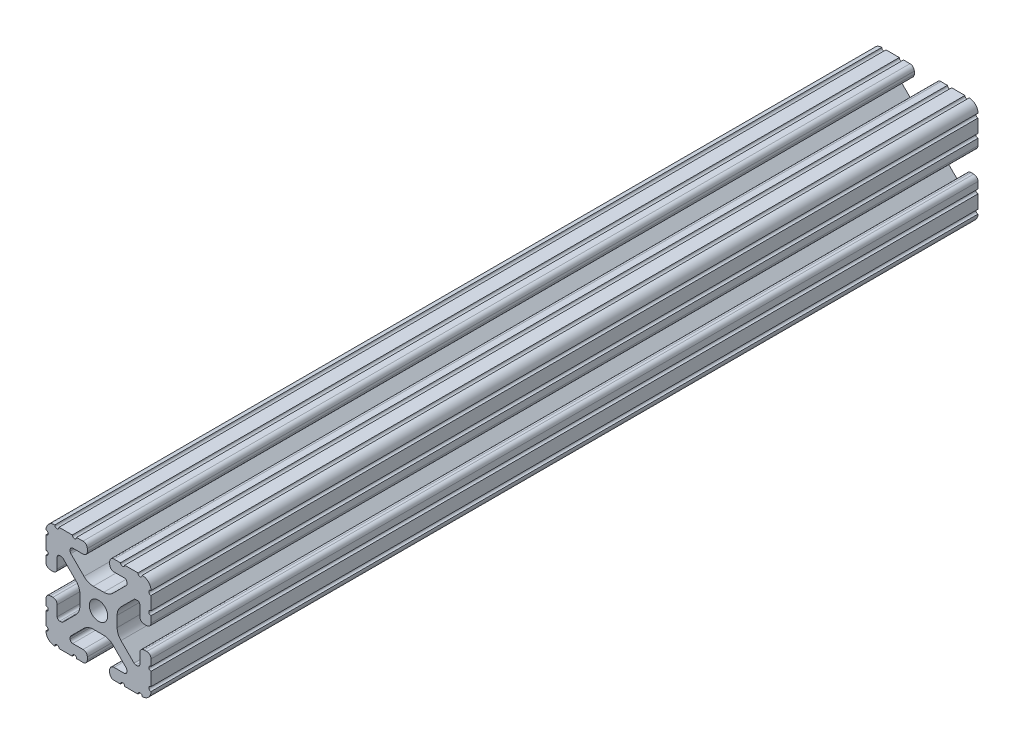
from build123d import *

# Parameters (mm, degrees)
SKETCH1_R      = 3.3274
EXTRUDE1_DEPTH = 300


with BuildPart() as part:
    # Sketch1 → Extrude1 (new body)
    with BuildSketch(Plane.XY):
        with BuildLine():
            Line((-10.022898969, 12.91475973), (-5.252158105, 8.144007132))
            ThreePointArc((-5.252158105, 8.144007132), (-3.715177372, 7.117027388), (-1.902183975, 6.7564))
            Line((-1.902183975, 6.7564), (1.902183975, 6.7564))
            ThreePointArc((1.902183975, 6.7564), (3.715177372, 7.117027388), (5.252158105, 8.144007132))
            Line((5.252158105, 8.144007132), (10.022898969, 12.91475973))
            ThreePointArc((10.022898969, 12.91475973), (10.218362387, 13.207291992), (10.287, 13.552357131))
            Line((10.287, 13.552357131), (10.287, 14.0843))
            ThreePointArc((10.287, 14.0843), (10.022898185, 14.721898185), (9.3853, 14.986))
            Line((9.3853, 14.986), (5.617617549, 14.986))
            ThreePointArc((5.617617549, 14.986), (4.519044045, 15.441044045), (4.064, 16.539617549))
            Line((4.064, 16.539617549), (4.064, 17.496382451))
            ThreePointArc((4.064, 17.496382451), (4.519044045, 18.594955955), (5.617617549, 19.05))
            Line((5.617617549, 19.05), (7.974178704, 19.05))
            ThreePointArc((7.974178704, 19.05), (8.736178704, 18.288), (9.498178704, 19.05))
            Line((9.498178704, 19.05), (14.327719207, 19.05))
            ThreePointArc((14.327719207, 19.05), (15.087603123, 18.231251131), (15.847487039, 19.05))
            ThreePointArc((15.847487039, 19.05), (18.120176289, 18.120192083), (19.05, 15.847509295))
            ThreePointArc((19.05, 15.847509295), (18.231250992, 15.08762539), (19.05, 14.327741484))
            Line((19.05, 14.327741484), (19.05, 9.496091471))
            ThreePointArc((19.05, 9.496091471), (18.231250992, 8.736207565), (19.05, 7.97632366))
            Line((19.05, 7.97632366), (19.05, 5.617617549))
            ThreePointArc((19.05, 5.617617549), (18.594955955, 4.519044045), (17.496382451, 4.064))
            Line((17.496382451, 4.064), (16.539617549, 4.064))
            ThreePointArc((16.539617549, 4.064), (15.441044045, 4.519044045), (14.986, 5.617617549))
            Line((14.986, 5.617617549), (14.986, 9.385342516))
            ThreePointArc((14.986, 9.385342516), (14.721898185, 10.022940701), (14.0843, 10.287042516))
            Line((14.0843, 10.287042516), (13.516042086, 10.287042516))
            ThreePointArc((13.516042086, 10.287042516), (13.170975923, 10.218404478), (12.878443117, 10.022939917))
            Line((12.878443117, 10.022939917), (8.14758008, 5.292065243))
            ThreePointArc((8.14758008, 5.292065243), (7.117955879, 3.751120653), (6.7564, 1.933453584))
            Line((6.7564, 1.933453584), (6.7564, -1.933453584))
            ThreePointArc((6.7564, -1.933453584), (7.117955879, -3.751120653), (8.14758008, -5.292065243))
            Line((8.14758008, -5.292065243), (12.878443117, -10.022939917))
            ThreePointArc((12.878443117, -10.022939917), (13.170975923, -10.218404478), (13.516042086, -10.287042516))
            Line((13.516042086, -10.287042516), (14.0843, -10.287042516))
            ThreePointArc((14.0843, -10.287042516), (14.721898185, -10.022940701), (14.986, -9.385342516))
            Line((14.986, -9.385342516), (14.986, -5.617617549))
            ThreePointArc((14.986, -5.617617549), (15.441044045, -4.519044045), (16.539617549, -4.064))
            Line((16.539617549, -4.064), (17.496382451, -4.064))
            ThreePointArc((17.496382451, -4.064), (18.594955955, -4.519044045), (19.05, -5.617617549))
            Line((19.05, -5.617617549), (19.05, -7.976318491))
            ThreePointArc((19.05, -7.976318491), (18.231250992, -8.736202396), (19.05, -9.496086302))
            Line((19.05, -9.496086302), (19.05, -14.32774291))
            ThreePointArc((19.05, -14.32774291), (18.231250992, -15.087626816), (19.05, -15.847510721))
            ThreePointArc((19.05, -15.847510721), (18.120175716, -18.120192644), (15.847486868, -19.05))
            ThreePointArc((15.847486868, -19.05), (15.087602952, -18.231251131), (14.327719036, -19.05))
            Line((14.327719036, -19.05), (9.496062448, -19.05))
            ThreePointArc((9.496062448, -19.05), (8.736178532, -18.231251131), (7.976294616, -19.05))
            Line((7.976294616, -19.05), (5.617617549, -19.05))
            ThreePointArc((5.617617549, -19.05), (4.519044045, -18.594955955), (4.064, -17.496382451))
            Line((4.064, -17.496382451), (4.064, -16.539617549))
            ThreePointArc((4.064, -16.539617549), (4.519044045, -15.441044045), (5.617617549, -14.986))
            Line((5.617617549, -14.986), (9.3853, -14.986))
            ThreePointArc((9.3853, -14.986), (10.022898185, -14.721898185), (10.287, -14.0843))
            Line((10.287, -14.0843), (10.287, -13.552357131))
            ThreePointArc((10.287, -13.552357131), (10.218362387, -13.207291992), (10.022898969, -12.91475973))
            Line((10.022898969, -12.91475973), (5.252158105, -8.144007132))
            ThreePointArc((5.252158105, -8.144007132), (3.715177372, -7.117027388), (1.902183975, -6.7564))
            Line((1.902183975, -6.7564), (-1.902183975, -6.7564))
            ThreePointArc((-1.902183975, -6.7564), (-3.715177372, -7.117027388), (-5.252158105, -8.144007132))
            Line((-5.252158105, -8.144007132), (-10.022898969, -12.91475973))
            ThreePointArc((-10.022898969, -12.91475973), (-10.218362387, -13.207291992), (-10.287, -13.552357131))
            Line((-10.287, -13.552357131), (-10.287, -14.0843))
            ThreePointArc((-10.287, -14.0843), (-10.022898185, -14.721898185), (-9.3853, -14.986))
            Line((-9.3853, -14.986), (-5.617617549, -14.986))
            ThreePointArc((-5.617617549, -14.986), (-4.519044045, -15.441044045), (-4.064, -16.539617549))
            Line((-4.064, -16.539617549), (-4.064, -17.496382451))
            ThreePointArc((-4.064, -17.496382451), (-4.519044045, -18.594955955), (-5.617617549, -19.05))
            Line((-5.617617549, -19.05), (-7.976294616, -19.05))
            ThreePointArc((-7.976294616, -19.05), (-8.736178532, -18.231251131), (-9.496062448, -19.05))
            Line((-9.496062448, -19.05), (-14.327719036, -19.05))
            ThreePointArc((-14.327719036, -19.05), (-15.087602952, -18.231251131), (-15.847486868, -19.05))
            ThreePointArc((-15.847486868, -19.05), (-18.120175716, -18.120192644), (-19.05, -15.847510721))
            ThreePointArc((-19.05, -15.847510721), (-18.231250992, -15.087626816), (-19.05, -14.32774291))
            Line((-19.05, -14.32774291), (-19.05, -9.496086302))
            ThreePointArc((-19.05, -9.496086302), (-18.231250992, -8.736202396), (-19.05, -7.976318491))
            Line((-19.05, -7.976318491), (-19.05, -5.617617549))
            ThreePointArc((-19.05, -5.617617549), (-18.594955955, -4.519044045), (-17.496382451, -4.064))
            Line((-17.496382451, -4.064), (-16.539617549, -4.064))
            ThreePointArc((-16.539617549, -4.064), (-15.441044045, -4.519044045), (-14.986, -5.617617549))
            Line((-14.986, -5.617617549), (-14.986, -9.385342516))
            ThreePointArc((-14.986, -9.385342516), (-14.721898185, -10.022940701), (-14.0843, -10.287042516))
            Line((-14.0843, -10.287042516), (-13.516042086, -10.287042516))
            ThreePointArc((-13.516042086, -10.287042516), (-13.170975923, -10.218404478), (-12.878443117, -10.022939917))
            Line((-12.878443117, -10.022939917), (-8.14758008, -5.292065243))
            ThreePointArc((-8.14758008, -5.292065243), (-7.117955879, -3.751120653), (-6.7564, -1.933453584))
            Line((-6.7564, -1.933453584), (-6.7564, 1.933453584))
            ThreePointArc((-6.7564, 1.933453584), (-7.117955879, 3.751120653), (-8.14758008, 5.292065243))
            Line((-8.14758008, 5.292065243), (-12.878443117, 10.022939917))
            ThreePointArc((-12.878443117, 10.022939917), (-13.170975923, 10.218404478), (-13.516042086, 10.287042516))
            Line((-13.516042086, 10.287042516), (-14.0843, 10.287042516))
            ThreePointArc((-14.0843, 10.287042516), (-14.721898185, 10.022940701), (-14.986, 9.385342516))
            Line((-14.986, 9.385342516), (-14.986, 5.617617549))
            ThreePointArc((-14.986, 5.617617549), (-15.441044045, 4.519044045), (-16.539617549, 4.064))
            Line((-16.539617549, 4.064), (-17.496382451, 4.064))
            ThreePointArc((-17.496382451, 4.064), (-18.594955955, 4.519044045), (-19.05, 5.617617549))
            Line((-19.05, 5.617617549), (-19.05, 7.97632366))
            ThreePointArc((-19.05, 7.97632366), (-18.231250992, 8.736207565), (-19.05, 9.496091471))
            Line((-19.05, 9.496091471), (-19.05, 14.327741484))
            ThreePointArc((-19.05, 14.327741484), (-18.231250992, 15.08762539), (-19.05, 15.847509295))
            ThreePointArc((-19.05, 15.847509295), (-18.120176289, 18.120192083), (-15.847487039, 19.05))
            ThreePointArc((-15.847487039, 19.05), (-15.087603123, 18.231251131), (-14.327719207, 19.05))
            Line((-14.327719207, 19.05), (-9.498178704, 19.05))
            ThreePointArc((-9.498178704, 19.05), (-8.736178704, 18.288), (-7.974178704, 19.05))
            Line((-7.974178704, 19.05), (-5.617617549, 19.05))
            ThreePointArc((-5.617617549, 19.05), (-4.519044045, 18.594955955), (-4.064, 17.496382451))
            Line((-4.064, 17.496382451), (-4.064, 16.539617549))
            ThreePointArc((-4.064, 16.539617549), (-4.519044045, 15.441044045), (-5.617617549, 14.986))
            Line((-5.617617549, 14.986), (-9.3853, 14.986))
            ThreePointArc((-9.3853, 14.986), (-10.022898185, 14.721898185), (-10.287, 14.0843))
            Line((-10.287, 14.0843), (-10.287, 13.552357131))
            ThreePointArc((-10.287, 13.552357131), (-10.218362387, 13.207291992), (-10.022898969, 12.91475973))
        make_face()
        Circle(SKETCH1_R, mode=Mode.SUBTRACT)
    extrude(amount=-EXTRUDE1_DEPTH)


solid = part.part
